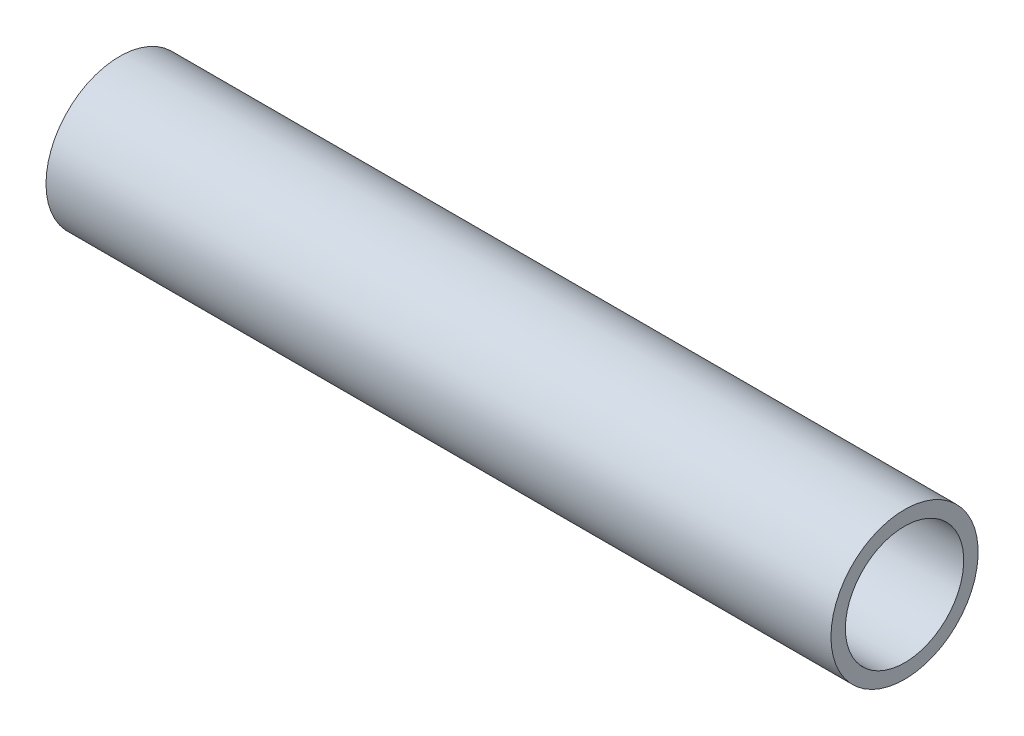
from build123d import *

# Parameters (mm, degrees)
SKETCH1_R           = 57.15
SKETCH1_R_2         = 45.9486
BOSS_EXTRUDE1_DEPTH = 609.6


with BuildPart() as part:
    # Sketch1 → Boss-Extrude1 (new body)
    with BuildSketch(Plane(origin=(0, 0, 0), x_dir=(0, 0, -1), z_dir=(1, 0, 0))):
        Circle(SKETCH1_R)
        Circle(SKETCH1_R_2, mode=Mode.SUBTRACT)
    extrude(amount=BOSS_EXTRUDE1_DEPTH)


solid = part.part
